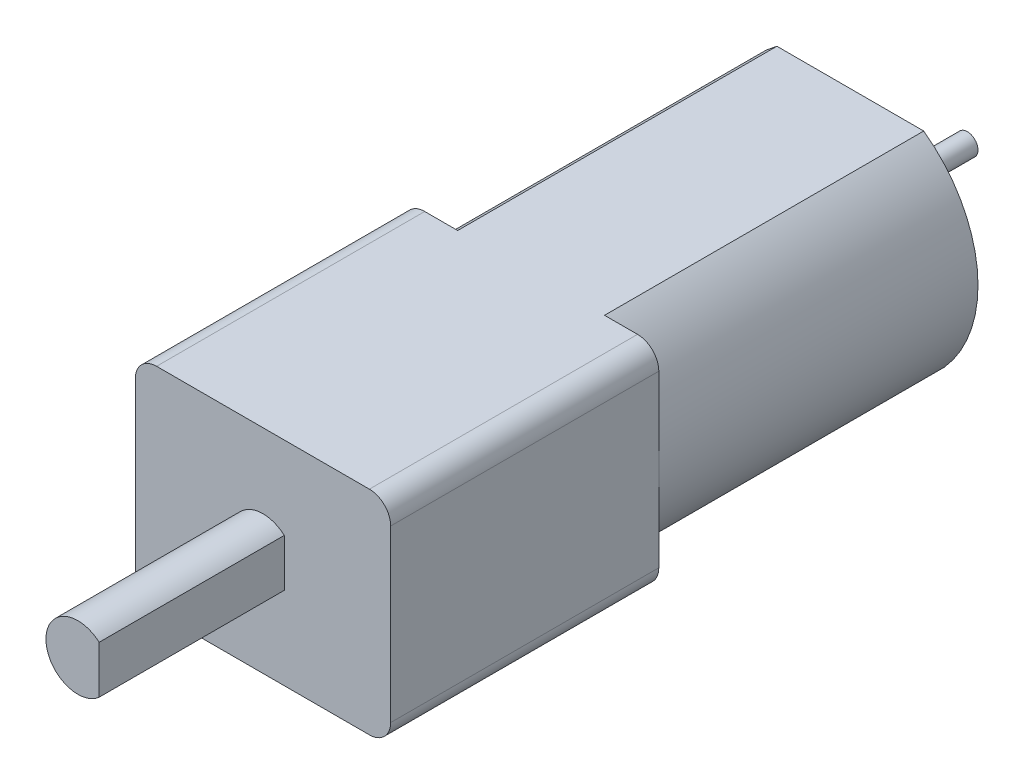
from build123d import *

# Parameters (mm, degrees)
BOSS_EXTRUDE1_DEPTH = 15
SKETCH2_W           = 12
SKETCH2_H           = 10
BOSS_EXTRUDE2_DEPTH = 12.6
FILLET1_R           = 1
BOSS_EXTRUDE3_DEPTH = 8.7
SKETCH4_R           = 2.5
BOSS_EXTRUDE4_DEPTH = 1.3
SKETCH5_R           = 0.5
BOSS_EXTRUDE5_DEPTH = 4.2


with BuildPart() as part:
    # Sketch1 → Boss-Extrude1 (new body)
    with BuildSketch(Plane.XY):
        with BuildLine():
            Line((-3.45, 5), (3.45, 5))
            ThreePointArc((3.45, 5), (6, 0), (3.45, -5))
            Line((3.45, -5), (-3.45, -5))
            ThreePointArc((-3.45, -5), (-6, 0), (-3.45, 5))
        make_face()
    extrude(amount=BOSS_EXTRUDE1_DEPTH)

    # Sketch2 → Boss-Extrude2 (add)
    with BuildSketch(Plane.XY.offset(15)):
        Rectangle(SKETCH2_W, SKETCH2_H)
    extrude(amount=BOSS_EXTRUDE2_DEPTH)

    # Fillet1
    fillet1_edges = [part.edges().sort_by_distance(p)[0] for p in [
        (6, 5, 21.3),
        (6, -5, 21.3),
        (-6, -5, 21.3),
        (-6, 5, 21.3),
    ]]
    fillet(fillet1_edges, radius=FILLET1_R)

    # Sketch3 → Boss-Extrude3 (add)
    with BuildSketch(Plane.XY.offset(27.6)):
        with BuildLine():
            Line((1, 1.118033989), (1, -1.118033989))
            ThreePointArc((1, -1.118033989), (-1.5, 0), (1, 1.118033989))
        make_face()
    extrude(amount=BOSS_EXTRUDE3_DEPTH)

    # Sketch4 → Boss-Extrude4 (add)
    with BuildSketch(Plane(origin=(0, 0, 0), x_dir=(-1, 0, 0), z_dir=(0, 0, -1))):
        Circle(SKETCH4_R)
    extrude(amount=BOSS_EXTRUDE4_DEPTH)

    # Sketch5 → Boss-Extrude5 (add)
    with BuildSketch(Plane(origin=(0, 0, -1.3), x_dir=(-1, 0, 0), z_dir=(0, 0, -1))):
        Circle(SKETCH5_R)
    extrude(amount=BOSS_EXTRUDE5_DEPTH)


solid = part.part
